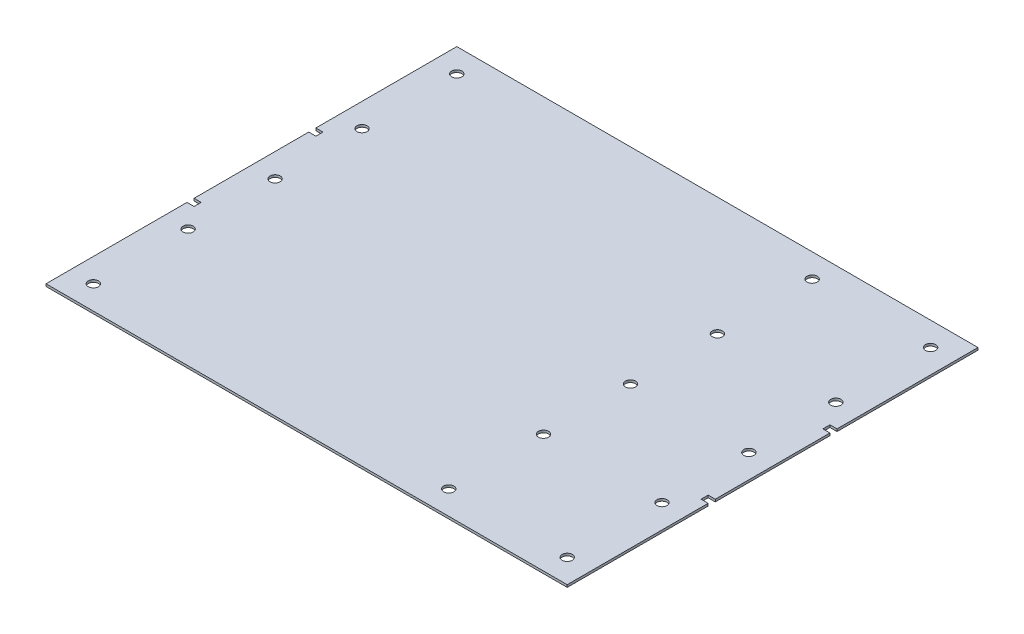
from build123d import *

# Parameters (mm, degrees)
SKETCH1_R           = 2.15
BOSS_EXTRUDE1_DEPTH = 1


with BuildPart() as part:
    # Sketch1 → Boss-Extrude1 (new body)
    with BuildSketch(Plane(origin=(0, 0, 0), x_dir=(1, 0, 0), z_dir=(0, 1, 0))):
        Polygon((-7, -27.2), (-10, -27.2), (-10, -86.7), (210, -86.7), (210, -27.2), (207, -27.2), (207, -24.2), (210, -24.2), (210, 24.2), (207, 24.2), (207, 27.2), (210, 27.2), (210, 86.7), (-10, 86.7), (-10, 27.2), (-7, 27.2), (-7, 24.2), (-10, 24.2), (-10, -24.2), (-7, -24.2), align=None)
        with Locations((0, -76.7)):
            Circle(SKETCH1_R, mode=Mode.SUBTRACT)
        with Locations((0, -36.7)):
            Circle(SKETCH1_R, mode=Mode.SUBTRACT)
        Circle(SKETCH1_R, mode=Mode.SUBTRACT)
        with Locations((150, -76.7)):
            Circle(SKETCH1_R, mode=Mode.SUBTRACT)
        with Locations((200, -76.7)):
            Circle(SKETCH1_R, mode=Mode.SUBTRACT)
        with Locations((150, -36.7)):
            Circle(SKETCH1_R, mode=Mode.SUBTRACT)
        with Locations((150, 0)):
            Circle(SKETCH1_R, mode=Mode.SUBTRACT)
        with Locations((200, -36.7)):
            Circle(SKETCH1_R, mode=Mode.SUBTRACT)
        with Locations((200, 0)):
            Circle(SKETCH1_R, mode=Mode.SUBTRACT)
        with Locations((0, 36.7)):
            Circle(SKETCH1_R, mode=Mode.SUBTRACT)
        with Locations((0, 76.7)):
            Circle(SKETCH1_R, mode=Mode.SUBTRACT)
        with Locations((150, 36.7)):
            Circle(SKETCH1_R, mode=Mode.SUBTRACT)
        with Locations((200, 36.7)):
            Circle(SKETCH1_R, mode=Mode.SUBTRACT)
        with Locations((150, 76.7)):
            Circle(SKETCH1_R, mode=Mode.SUBTRACT)
        with Locations((200, 76.7)):
            Circle(SKETCH1_R, mode=Mode.SUBTRACT)
    extrude(amount=BOSS_EXTRUDE1_DEPTH)


solid = part.part
